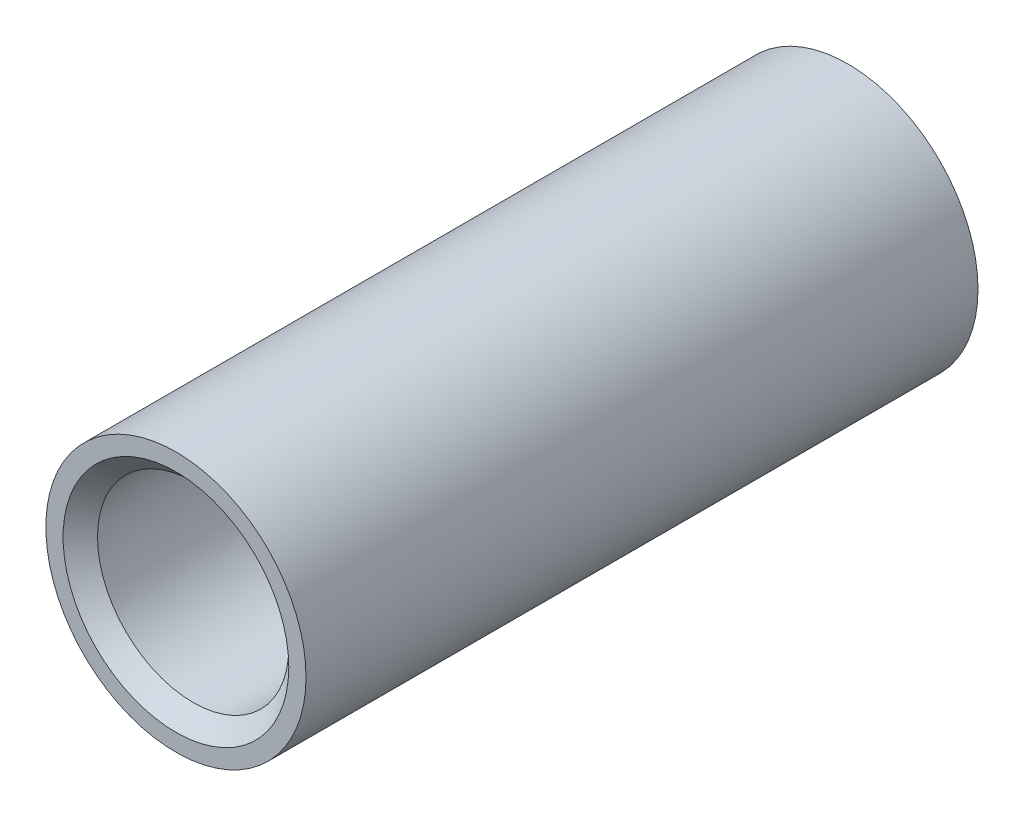
from build123d import *

# Parameters (mm, degrees)
SKETCH_1_R            = 15.1
EXTRUDE_1_DEPTH       = 39
SKETCH_4_R            = 11.1
CUT_EXTRUDE_475_DEPTH = 45.463693054
EXTRUDE_START         = -39
SKETCH_1_6_R          = 15.1
EXTRUDE_3_DEPTH       = 39
SKETCH_12_R           = 11
CUT_EXTRUDE_2_DEPTH   = 80


with BuildPart() as part:
    # 草图1 → 凸台-拉伸1 (new body)
    with BuildSketch(Plane.XY):
        Circle(SKETCH_1_R)
    extrude(amount=EXTRUDE_1_DEPTH)

    # 草图4 → Cut-Extrude 475 (cut, through all)
    with BuildSketch(Plane.XY.offset(39)):
        Circle(SKETCH_4_R)
    extrude(amount=-CUT_EXTRUDE_475_DEPTH, mode=Mode.SUBTRACT)

    # 草图8 → 切除-旋转1 (revolve, cut)
    with BuildSketch(Plane(origin=(0, 0, 0), x_dir=(1, 0, 0), z_dir=(0, 1, 0))):
        Polygon((-11.1, -37), (-11.1, -39), (-13.1, -39), align=None)
    revolve(axis=Axis((0, 0, 0), (0, 0, -1)), mode=Mode.SUBTRACT)

    # 草图1<6> → 凸台-拉伸3 (add)
    with BuildSketch(Plane.XY.offset(EXTRUDE_START)):
        Circle(SKETCH_1_6_R)
    extrude(amount=EXTRUDE_3_DEPTH)

    # 草图12 → 切除-拉伸2 (cut)
    with BuildSketch(Plane.XY):
        Circle(SKETCH_12_R)
    extrude(amount=-CUT_EXTRUDE_2_DEPTH, mode=Mode.SUBTRACT)

    # 草图14 → 切除-旋转2 (revolve, cut)
    with BuildSketch(Plane(origin=(0, 0, 0), x_dir=(1, 0, 0), z_dir=(0, 1, 0))):
        Polygon((11, 39), (13, 39), (11, 37), align=None)
    revolve(axis=Axis((0, 0, -39), (0, 0, 1)), mode=Mode.SUBTRACT)


solid = part.part
